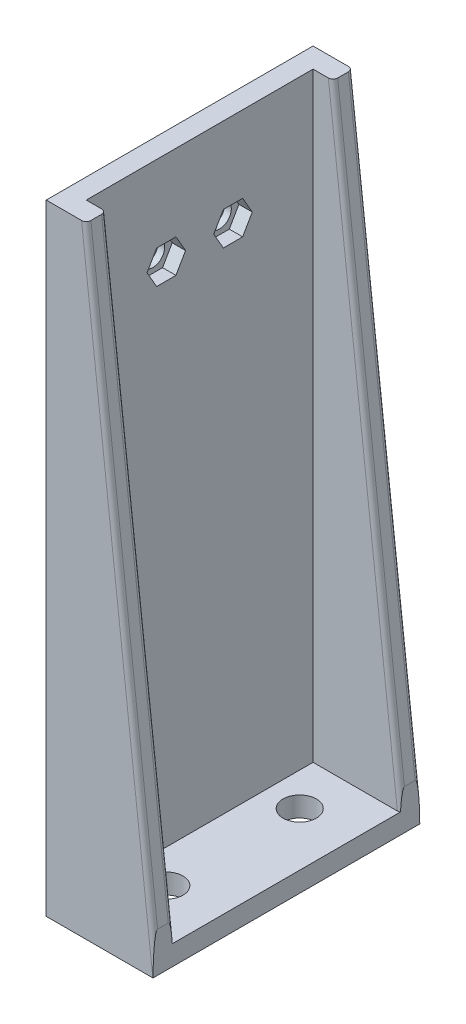
from build123d import *

# Parameters (mm, degrees)
SKETCH1_W               = 16
SKETCH1_H               = 40
SKETCH1_R               = 2.5
BOSS_EXTRUDE1_DEPTH     = 3
BOSS_EXTRUDE3_START     = -3
SKETCH2_W               = 13
SKETCH2_H               = 3
SKETCH2_W_2             = 3
SKETCH2_H_2             = 34
BOSS_EXTRUDE3_DEPTH     = 93
CUT_EXTRUDE1_DEPTH      = 102.552941858
CUT_EXTRUDE1_DEPTH_BACK = 102.552941858
CUT_EXTRUDE2_START      = -1
SKETCH4_R               = 1.75
CUT_EXTRUDE2_DEPTH      = 102.493902258
SKETCH4_AGAIN_R         = 1.75
CUT_EXTRUDE3_DEPTH      = 103.493902258
FILLET1_R               = 0.7


with BuildPart() as part:
    # Sketch1 → Boss-Extrude1 (new body)
    with BuildSketch(Plane(origin=(0, 0, 0), x_dir=(1, 0, 0), z_dir=(0, 1, 0))):
        with Locations((0, 20)):
            Rectangle(SKETCH1_W, SKETCH1_H)
        with Locations(Location((0, 30, 0), (0, 0, 270))):
            Circle(SKETCH1_R, mode=Mode.SUBTRACT)
        with Locations(Location((0, 10, 0), (0, 0, 270))):
            Circle(SKETCH1_R, mode=Mode.SUBTRACT)
    extrude(amount=BOSS_EXTRUDE1_DEPTH)

    # Sketch2 → Boss-Extrude3 (add)
    with BuildSketch(Plane(origin=(0, 3, 0), x_dir=(1, 0, 0), z_dir=(0, 1, 0)).offset(BOSS_EXTRUDE3_START)):
        with Locations((1.5, 38.5)):
            Rectangle(SKETCH2_W, SKETCH2_H)
        with Locations((-6.5, 38.5)):
            Rectangle(SKETCH2_W_2, SKETCH2_H)
        with Locations((-6.5, 20)):
            Rectangle(SKETCH2_W_2, SKETCH2_H_2)
        with Locations((-6.5, 1.5)):
            Rectangle(SKETCH2_W_2, SKETCH2_H)
        with Locations((1.5, 1.5)):
            Rectangle(SKETCH2_W, SKETCH2_H)
    extrude(amount=BOSS_EXTRUDE3_DEPTH)

    # Sketch3 → Cut-Extrude1 (cut, two sides: drawn at the far end of the back side and taken through both)
    with BuildSketch(Plane(origin=(0, 0, -40), x_dir=(-1, 0, 0), z_dir=(0, 0, -1)).offset(-CUT_EXTRUDE1_DEPTH_BACK)):
        Polygon((-8, 6), (2, 93), (-8, 93), align=None)
    extrude(amount=CUT_EXTRUDE1_DEPTH + CUT_EXTRUDE1_DEPTH_BACK, mode=Mode.SUBTRACT)

    # Sketch4 → Cut-Extrude2 (cut, through all)
    # profile 1 of 2: a face of its own
    with BuildSketch(Plane.ZY.offset(8).offset(CUT_EXTRUDE2_START)):
        Polygon((-13.556624327, 76.5), (-12.113248654, 79), (-13.556624327, 81.5), (-16.443375673, 81.5), (-17.886751346, 79), (-16.443375673, 76.5), align=None)
        with Locations((-15, 79)):
            Circle(SKETCH4_R, mode=Mode.SUBTRACT)
    # profile 2 of 2: a face of its own
    with BuildSketch(Plane.ZY.offset(8).offset(CUT_EXTRUDE2_START)):
        Polygon((-23.556624327, 76.5), (-22.113248654, 79), (-23.556624327, 81.5), (-26.443375673, 81.5), (-27.886751346, 79), (-26.443375673, 76.5), align=None)
        with Locations((-25, 79)):
            Circle(SKETCH4_R, mode=Mode.SUBTRACT)
    extrude(amount=-CUT_EXTRUDE2_DEPTH, mode=Mode.SUBTRACT)

    # Sketch4 again → Cut-Extrude3 (cut, through all)
    with BuildSketch(Plane.ZY.offset(8)):
        with Locations((-25, 79)):
            Circle(SKETCH4_AGAIN_R)
        with Locations((-15, 79)):
            Circle(SKETCH4_AGAIN_R)
    extrude(amount=-CUT_EXTRUDE3_DEPTH, mode=Mode.SUBTRACT)

    # Fillet1
    fillet1_edges = [part.edges().sort_by_distance(p)[0] for p in [
        (3, 49.5, 0),
    ]]
    fillet(fillet1_edges, radius=FILLET1_R)
    fillet1_2_edges = [part.edges().sort_by_distance(p)[0] for p in [
        (3, 49.5, -3),
    ]]
    fillet(fillet1_2_edges, radius=FILLET1_R)
    fillet1_3_edges = [part.edges().sort_by_distance(p)[0] for p in [
        (3, 49.5, -40),
    ]]
    fillet(fillet1_3_edges, radius=FILLET1_R)
    fillet1_4_edges = [part.edges().sort_by_distance(p)[0] for p in [
        (3, 49.5, -37),
    ]]
    fillet(fillet1_4_edges, radius=FILLET1_R)


solid = part.part
